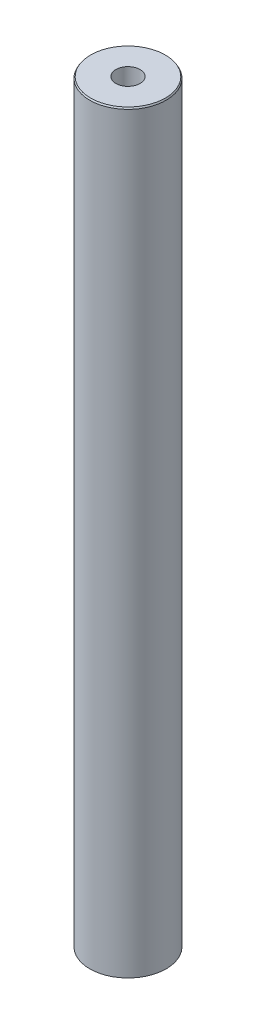
from build123d import *
from OCP.BRepFilletAPI import BRepFilletAPI_MakeChamfer

# Parameters (mm, degrees)
SKETCH1_R           = 7.5
BOSS_EXTRUDE1_DEPTH = 148.133478999
SKETCH2_R           = 2.377710837
CUT_EXTRUDE1_DEPTH  = 149.512718648
CHAMFER1_SIZE       = 0.287651134
CHAMFER1_SIZE2      = 0.166075459


with BuildPart() as part:
    # Sketch1 → Boss-Extrude1 (new body)
    with BuildSketch(Plane(origin=(0, 0, 0), x_dir=(1, 0, 0), z_dir=(0, 1, 0))):
        Circle(SKETCH1_R)
    extrude(amount=BOSS_EXTRUDE1_DEPTH)

    # Sketch2 → Cut-Extrude1 (cut, through all)
    with BuildSketch(Plane(origin=(0, 0, 0), x_dir=(1, 0, 0), z_dir=(0, 1, 0))):
        Circle(SKETCH2_R)
    extrude(amount=CUT_EXTRUDE1_DEPTH, mode=Mode.SUBTRACT)

    # Chamfer1: one chamfer whose edges measure the first distance from different faces: ONE call of the kernel's chamfer builder (chamfer() names one face for all edges)
    chamfer1_edges_1 = [part.edges().sort_by_distance(p)[0] for p in [
        (-7.5, 148.133478999, 0),
    ]]
    chamfer1_side_1 = [part.faces().sort_by_distance(p)[0] for p in [
        (-7.5, 74.066739499, 0),
    ]]
    chamfer1_edges_2 = [part.edges().sort_by_distance(p)[0] for p in [
        (-7.5, 0, 0),
    ]]
    chamfer1_side_2 = [part.faces().sort_by_distance(p)[0] for p in [
        (-7.287867966, 0, 0),
    ]]
    chamfer1 = BRepFilletAPI_MakeChamfer(part.part.solid().wrapped)
    for e in chamfer1_edges_1:
        chamfer1.Add(CHAMFER1_SIZE, CHAMFER1_SIZE2, e.wrapped, chamfer1_side_1[0].wrapped)  # the first distance lies on this face
    for e in chamfer1_edges_2:
        chamfer1.Add(CHAMFER1_SIZE, CHAMFER1_SIZE2, e.wrapped, chamfer1_side_2[0].wrapped)  # the first distance lies on this face
    add(Compound.cast(chamfer1.Shape()), mode=Mode.REPLACE)


solid = part.part
